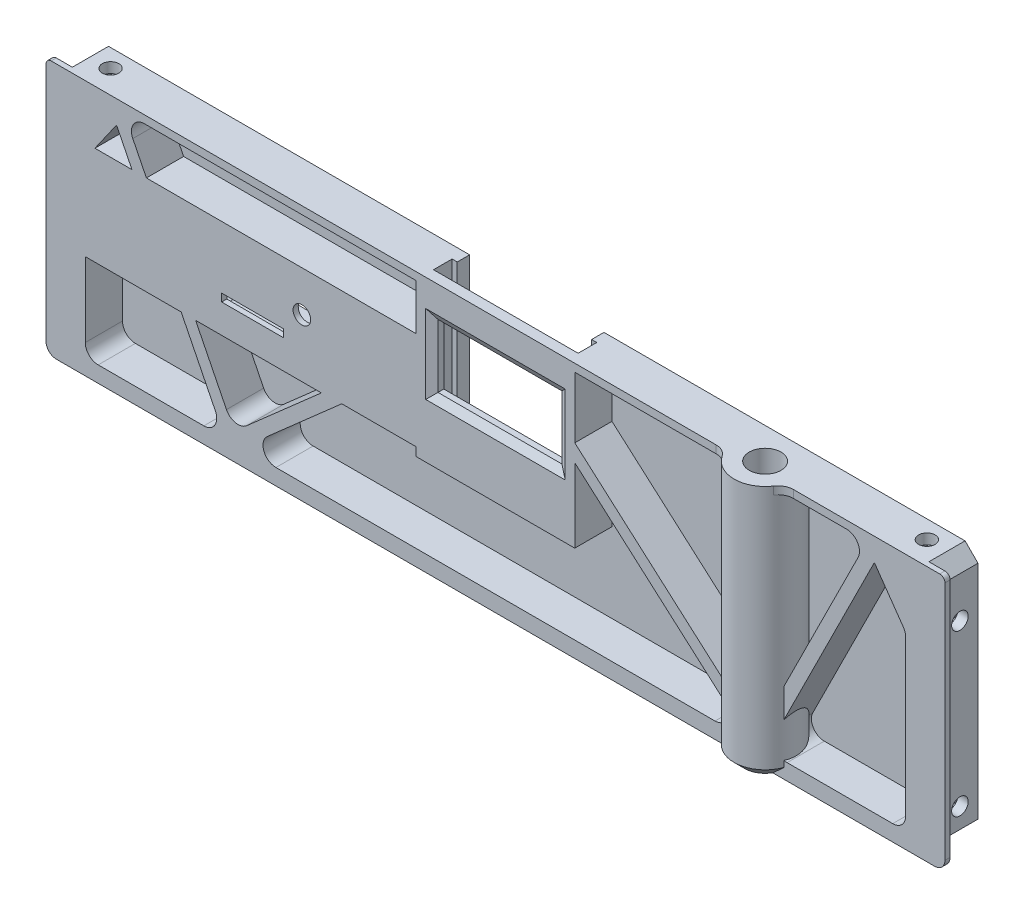
from build123d import *

# Parameters (mm, degrees)
SKETCH1_W                 = 174
SKETCH1_H                 = 51.1
BOSS_EXTRUDE1_DEPTH       = 8
SKETCH2_OUTSIDE_W         = 212.304
SKETCH2_OUTSIDE_H         = 89.404
SKETCH2_OUTSIDE_W_2       = 170.8
SKETCH2_OUTSIDE_H_2       = 47.9
CUT_EXTRUDE1_DEPTH        = 7
CHAMFER1_SIZE             = 2.5
FILLET1_R                 = 2
SKETCH3_W                 = 158.8
SKETCH3_H                 = 44.9
CUT_EXTRUDE2_DEPTH        = 7.2
BOSS_EXTRUDE2_DEPTH       = 7.2
F_3_0MM_DOWEL_HOLE1_D     = 3.2
F_3_0MM_DOWEL_HOLE1_DEPTH = 5
F_3_0MM_DOWEL_HOLE2_D     = 3.2
F_3_0MM_DOWEL_HOLE2_DEPTH = 5
CUT_EXTRUDE3_START        = -2
SKETCH10_W                = 6.25
SKETCH10_H                = 5.5
CUT_EXTRUDE3_DEPTH        = 1.8
CUT_EXTRUDE4_START        = -2
SKETCH11_W                = 5.5
SKETCH11_H                = 6.25
CUT_EXTRUDE4_DEPTH        = 1.8
BOSS_EXTRUDE3_DEPTH       = 7.2
SMALL_FIX_DEPTH           = 7.2
FILLET2_R                 = 2.5
FILLET3_R                 = 0.1
SKETCH14_W                = 30.7
SKETCH14_H                = 31
BOSS_EXTRUDE4_DEPTH       = 8
SKETCH17_W                = 28
SKETCH17_H                = 3.6
CUT_EXTRUDE6_DEPTH        = 29.5
SKETCH18_W                = 26
SKETCH18_H                = 26.5
CUT_EXTRUDE7_DEPTH        = 6
SKETCH19_W                = 24
SKETCH19_H                = 12.25
CUT_EXTRUDE8_DEPTH        = 2
CHAMFER2_SIZE             = 1.5
CHAMFER2_SIZE2            = 0.866025404
SKETCH21_W                = 174
SKETCH21_H                = 1.6
CUT_EXTRUDE10_DEPTH       = 91.94395252
BOSS_EXTRUDE5_DEPTH       = 7.2
SKETCH23_W                = 59
SKETCH23_H                = 11.6
CUT_EXTRUDE11_DEPTH       = 7
SKETCH25_W                = 35
SKETCH25_H                = 2
CUT_EXTRUDE12_DEPTH       = 7
SKETCH26_W                = 5
SKETCH26_H                = 9.4
SKETCH26_W_2              = 7
BOSS_EXTRUDE6_DEPTH       = 7
SKETCH27_R                = 1.7
SKETCH27_W                = 12
SKETCH27_H                = 1.5
CUT_EXTRUDE13_DEPTH       = 1
FILLET4_R                 = 1
BOSS_EXTRUDE8_REACH       = 102.415
SKETCH29_R                = 6
SKETCH30_R                = 3.075
CUT_EXTRUDE14_DEPTH       = 43.9
SKETCH31_W                = 12
SKETCH31_H                = 7
CUT_EXTRUDE15_DEPTH       = 1.6
CHAMFER3_SIZE             = 2
FILLET5_R                 = 3
SKETCH32_W                = 5.5
SKETCH32_H                = 1.8
SKETCH32_W_2              = 1.8
SKETCH32_H_2              = 5.5
CUT_EXTRUDE17_DEPTH       = 0.1
BOSS_EXTRUDE9_DEPTH       = 7.2
SKETCH34_W                = 23.2
SKETCH34_H                = 5.1
SKETCH34_W_2              = 10.25
SKETCH34_H_2              = 15
CUT_EXTRUDE18_DEPTH       = 7
CUT_EXTRUDE19_START       = -2
SKETCH10_2_W              = 6.25
SKETCH10_2_H              = 5.5
CUT_EXTRUDE19_DEPTH       = 1.8
SKETCH36_R                = 1.6
CUT_EXTRUDE20_DEPTH       = 5
SKETCH37_W                = 12
SKETCH37_H                = 0.5
BOSS_EXTRUDE10_DEPTH      = 1
SKETCH37_3_W              = 12
SKETCH37_3_H              = 1.5
CUT_EXTRUDE21_DEPTH       = 10


with BuildPart() as part:
    # Sketch1 → Boss-Extrude1 (new body)
    with BuildSketch(Plane.XY):
        Rectangle(SKETCH1_W, SKETCH1_H)
    extrude(amount=-BOSS_EXTRUDE1_DEPTH)

    # Sketch2 outside → Cut-Extrude1 (cut)
    with BuildSketch(Plane(origin=(0, 0, -8), x_dir=(-1, 0, 0), z_dir=(0, 0, -1))):
        Rectangle(SKETCH2_OUTSIDE_W, SKETCH2_OUTSIDE_H)
        Rectangle(SKETCH2_OUTSIDE_W_2, SKETCH2_OUTSIDE_H_2, mode=Mode.SUBTRACT)
    extrude(amount=-CUT_EXTRUDE1_DEPTH, mode=Mode.SUBTRACT)

    # Chamfer1
    chamfer1_edges = [part.edges().sort_by_distance(p)[0] for p in [
        (85.4, -23.95, -4.5),
        (85.4, 23.95, -4.5),
        (-85.4, 23.95, -4.5),
        (-85.4, -23.95, -4.5),
    ]]
    chamfer(chamfer1_edges, length=CHAMFER1_SIZE)

    # Fillet1
    fillet1_edges = [part.edges().sort_by_distance(p)[0] for p in [
        (-87, -25.55, -0.5),
        (87, -25.55, -0.5),
    ]]
    fillet(fillet1_edges, radius=FILLET1_R)

    # Sketch3 → Cut-Extrude2 (cut)
    with BuildSketch(Plane.XY):
        Rectangle(SKETCH3_W, SKETCH3_H)
    extrude(amount=-CUT_EXTRUDE2_DEPTH, mode=Mode.SUBTRACT)

    # Sketch9 → Boss-Extrude2 (add)
    with BuildSketch(Plane.XY):
        Polygon((-73.4, 22.45), (-73.4, 19.45), (-79.4, 10.88111196), (-79.4, 22.45), align=None)
    boss_extrude2 = extrude(amount=-BOSS_EXTRUDE2_DEPTH)

    # Ø3.0mm Dowel Hole1
    with Locations(Plane.ZY.offset(85.4)):
        with Locations((-4.5, 13.55), (-4.5, -17.55)):
            f_3_0mm_dowel_hole1 = Hole(F_3_0MM_DOWEL_HOLE1_D / 2, depth=F_3_0MM_DOWEL_HOLE1_DEPTH)

    # Ø3.0mm Dowel Hole2
    with Locations(Plane(origin=(0, 23.95, 0), x_dir=(1, 0, 0), z_dir=(0, 1, 0))):
        with Locations((-79, 4.5)):
            f_3_0mm_dowel_hole2 = Hole(F_3_0MM_DOWEL_HOLE2_D / 2, depth=F_3_0MM_DOWEL_HOLE2_DEPTH)

    # Sketch10 → Cut-Extrude3 (cut)
    with BuildSketch(Plane.ZY.offset(85.4).offset(CUT_EXTRUDE3_START)):
        with Locations((-4.875, 13.55)):
            Rectangle(SKETCH10_W, SKETCH10_H)
        with Locations((-4.875, -17.55)):
            Rectangle(SKETCH10_W, SKETCH10_H)
    cut_extrude3 = extrude(amount=-CUT_EXTRUDE3_DEPTH, mode=Mode.SUBTRACT)

    # Sketch11 → Cut-Extrude4 (cut)
    with BuildSketch(Plane(origin=(0, 23.95, 0), x_dir=(1, 0, 0), z_dir=(0, 1, 0)).offset(CUT_EXTRUDE4_START)):
        with Locations((-79, 4.875)):
            Rectangle(SKETCH11_W, SKETCH11_H)
    cut_extrude4 = extrude(amount=-CUT_EXTRUDE4_DEPTH, mode=Mode.SUBTRACT)

    # Mirror1: Boss-Extrude2, Ø3.0mm Dowel Hole1, Ø3.0mm Dowel Hole2, Cut-Extrude3, Cut-Extrude4 across plane
    add(boss_extrude2.mirror(Plane(origin=(0, 0, 0), x_dir=(0, 0, 1), z_dir=(1, 0, 0))))
    add(f_3_0mm_dowel_hole1.mirror(Plane(origin=(0, 0, 0), x_dir=(0, 0, 1), z_dir=(1, 0, 0))), mode=Mode.SUBTRACT)
    add(f_3_0mm_dowel_hole2.mirror(Plane(origin=(0, 0, 0), x_dir=(0, 0, 1), z_dir=(1, 0, 0))), mode=Mode.SUBTRACT)
    add(cut_extrude3.mirror(Plane(origin=(0, 0, 0), x_dir=(0, 0, 1), z_dir=(1, 0, 0))), mode=Mode.SUBTRACT)
    add(cut_extrude4.mirror(Plane(origin=(0, 0, 0), x_dir=(0, 0, 1), z_dir=(1, 0, 0))), mode=Mode.SUBTRACT)

    # Sketch12 → Boss-Extrude3 (add)
    with BuildSketch(Plane.XY.offset(-7.2)):
        with BuildLine():
            Line((-74.518667952, 21.892252734), (-51.987365652, -23.298548404))
            ThreePointArc((-51.987365652, -23.298548404), (-51.284500977, -23.83373188), (-50.431737416, -23.603006041))
            Line((-50.431737416, -23.603006041), (0, 20.784788617))
            Line((0, 20.784788617), (50.431737416, -23.603006041))
            ThreePointArc((50.431737416, -23.603006041), (51.284500977, -23.83373188), (51.987365652, -23.298548404))
            Line((51.987365652, -23.298548404), (74.518667952, 21.892252734))
            ThreePointArc((74.518667952, 21.892252734), (73.957747266, 23.568667952), (72.281332048, 23.007747266))
            Line((72.281332048, 23.007747266), (50.619958341, -20.438247045))
            Line((50.619958341, -20.438247045), (0.660693874, 23.533697727))
            ThreePointArc((0.660693874, 23.533697727), (0, 23.783042277), (-0.660693874, 23.533697727))
            Line((-0.660693874, 23.533697727), (-50.619958341, -20.438247045))
            Line((-50.619958341, -20.438247045), (-72.281332048, 23.007747266))
            ThreePointArc((-72.281332048, 23.007747266), (-73.957747266, 23.568667952), (-74.518667952, 21.892252734))
        make_face()
    extrude(amount=BOSS_EXTRUDE3_DEPTH)

    # Sketch13 → Small Fix (add)
    with BuildSketch(Plane.XY):
        Polygon((-73.4, 19.45), (-73.4, 19.648551935), (-73.301005657, 19.45), align=None)
        Polygon((73.301005657, 19.45), (73.4, 19.45), (73.4, 19.648551935), align=None)
    extrude(amount=-SMALL_FIX_DEPTH)

    # Fillet2
    fillet2_edges = [part.edges().sort_by_distance(p)[0] for p in [
        (-79.4, 10.88111196, -3.6),
        (79.4, 10.88111196, -3.6),
        (49.121735458, -22.45, -3.6),
        (-49.121735458, -22.45, -3.6),
        (72.003249519, 22.45, -3.6),
        (1.89195034, 22.45, -3.6),
        (50.619958341, -20.438247045, -3.6),
        (-1.89195034, 22.45, -3.6),
        (-72.003249519, 22.45, -3.6),
        (-50.619958341, -20.438247045, -3.6),
        (0, 20.784788617, -3.6),
        (-52.410436279, -22.45, -3.6),
        (52.410436279, -22.45, -3.6),
        (-79.4, -22.45, -3.6),
        (79.4, -22.45, -3.6),
    ]]
    fillet(fillet2_edges, radius=FILLET2_R)

    # Fillet3
    # the kernel refuses this fillet: 0.1 mm, written as the material it adds along each edge
    with BuildSketch(Plane(origin=(73.4, 19.45, 0), x_dir=(-1, 0, 0), z_dir=(0, 0, -1))) as fillet3_piece_1:
        with BuildLine():
            CenterArc((FILLET3_R * 0.520567050552, -FILLET3_R), FILLET3_R, 90, 55)
            Line((-FILLET3_R * 0.298584993737, -FILLET3_R * 0.426423563649), (0, 0))
            Line((0, 0), (FILLET3_R * 0.520567050552, 0))
        make_face()
    extrude(amount=7.330141763)
    with BuildSketch(Plane(origin=(73.301005657, 19.45, 0), x_dir=(-0.44619781310983325, -0.8949343616020129, 0), z_dir=(0, 0, -1))) as fillet3_piece_2:
        with BuildLine():
            CenterArc((FILLET3_R * 0.618818776719, -FILLET3_R), FILLET3_R, 90, 63.5)
            Line((-FILLET3_R * 0.276115584883, -FILLET3_R * 0.55380218689), (0, 0))
            Line((0, 0), (FILLET3_R * 0.618818776719, 0))
        make_face()
    extrude(amount=7.354704694)
    with BuildSketch(Plane(origin=(-73.301005657, 19.45, 0), x_dir=(0.4461978131097644, -0.8949343616020471, 0), z_dir=(0, 0, -1))) as fillet3_piece_3:
        with BuildLine():
            CenterArc((FILLET3_R * 0.618818776719, FILLET3_R), FILLET3_R, 206.5, 63.5)
            Line((-FILLET3_R * 0.276115584883, FILLET3_R * 0.55380218689), (0, 0))
            Line((0, 0), (FILLET3_R * 0.618818776719, 0))
        make_face()
    extrude(amount=7.354704694)
    with BuildSketch(Plane(origin=(-73.4, 19.45, 0), x_dir=(1, 0, 0), z_dir=(0, 0, -1))) as fillet3_piece_4:
        with BuildLine():
            CenterArc((FILLET3_R * 0.520567050552, FILLET3_R), FILLET3_R, 215, 55)
            Line((-FILLET3_R * 0.298584993737, FILLET3_R * 0.426423563649), (0, 0))
            Line((0, 0), (FILLET3_R * 0.520567050552, 0))
        make_face()
    extrude(amount=7.330141763)

    # Sketch14 → Boss-Extrude4 (add)
    with BuildSketch(Plane(origin=(0, 0, -8), x_dir=(-1, 0, 0), z_dir=(0, 0, -1))):
        with Locations((0, 8.45)):
            Rectangle(SKETCH14_W, SKETCH14_H)
    extrude(amount=-BOSS_EXTRUDE4_DEPTH)

    # Sketch17 → Cut-Extrude6 (cut)
    with BuildSketch(Plane(origin=(0, 23.95, 0), x_dir=(1, 0, 0), z_dir=(0, 1, 0))):
        with Locations((0, 3.8)):
            Rectangle(SKETCH17_W, SKETCH17_H)
    extrude(amount=-CUT_EXTRUDE6_DEPTH, mode=Mode.SUBTRACT)

    # Sketch18 → Cut-Extrude7 (cut)
    with BuildSketch(Plane(origin=(0, 0, -8), x_dir=(-1, 0, 0), z_dir=(0, 0, -1))):
        with Locations((0, 10.7)):
            Rectangle(SKETCH18_W, SKETCH18_H)
    extrude(amount=-CUT_EXTRUDE7_DEPTH, mode=Mode.SUBTRACT)

    # Sketch19 → Cut-Extrude8 (cut)
    with BuildSketch(Plane.XY):
        with Locations((0, 11.075)):
            Rectangle(SKETCH19_W, SKETCH19_H)
    extrude(amount=-CUT_EXTRUDE8_DEPTH, mode=Mode.SUBTRACT)

    # Chamfer2
    chamfer2_edges = [part.edges().sort_by_distance(p)[0] for p in [
        (-12, 11.075, 0),
        (0, 4.95, 0),
        (12, 11.075, 0),
        (0, 17.2, 0),
    ]]
    chamfer2_side = [part.faces().sort_by_distance(p)[0] for p in [
        (0, 1.106366133, 0),
    ]]
    chamfer(chamfer2_edges, length=CHAMFER2_SIZE, length2=CHAMFER2_SIZE2, reference=chamfer2_side[0])

    # Sketch21 → Cut-Extrude10 (cut, through all)
    with BuildSketch(Plane(origin=(0, 0, -1), x_dir=(-1, 0, 0), z_dir=(0, 0, -1))):
        with Locations((0, 24.75)):
            Rectangle(SKETCH21_W, SKETCH21_H)
    extrude(amount=-CUT_EXTRUDE10_DEPTH, mode=Mode.SUBTRACT)

    # Sketch22 → Boss-Extrude5 (add)
    with BuildSketch(Plane.XY):
        Polygon((-79.4, -5.55), (-33.704493823, -5.55), (-15.35, 10.604817276), (-15.35, 13.55), (-23.6, 13.55), (-79.4, 13.55), align=None)
    extrude(amount=-BOSS_EXTRUDE5_DEPTH)

    # Sketch23 → Cut-Extrude11 (cut)
    with BuildSketch(Plane(origin=(0, 0, -8), x_dir=(-1, 0, 0), z_dir=(0, 0, -1))):
        with Locations((53.6, 6.75)):
            Rectangle(SKETCH23_W, SKETCH23_H)
    extrude(amount=-CUT_EXTRUDE11_DEPTH, mode=Mode.SUBTRACT)

    # Sketch25 → Cut-Extrude12 (cut)
    with BuildSketch(Plane(origin=(0, 0, -8), x_dir=(-1, 0, 0), z_dir=(0, 0, -1))):
        with Locations((49.6, -0.05)):
            Rectangle(SKETCH25_W, SKETCH25_H)
    extrude(amount=-CUT_EXTRUDE12_DEPTH, mode=Mode.SUBTRACT)

    # Sketch26 → Boss-Extrude6 (add)
    with BuildSketch(Plane(origin=(0, 0, -8), x_dir=(-1, 0, 0), z_dir=(0, 0, -1))):
        with Locations((26.6, 7.85)):
            Rectangle(SKETCH26_W, SKETCH26_H)
        with Locations((79.6, 7.85)):
            Rectangle(SKETCH26_W_2, SKETCH26_H)
    extrude(amount=-BOSS_EXTRUDE6_DEPTH)

    # Sketch27 → Cut-Extrude13 (cut)
    with BuildSketch(Plane.XY):
        with Locations((-37.475, 5.65)):
            Circle(SKETCH27_R)
        with Locations((-47.011, 0.285)):
            Rectangle(SKETCH27_W, SKETCH27_H)
    extrude(amount=-CUT_EXTRUDE13_DEPTH, mode=Mode.SUBTRACT)

    # Fillet4
    fillet4_edges = [part.edges().sort_by_distance(p)[0] for p in [
        (87, 23.95, -0.5),
        (-87, 23.95, -0.5),
    ]]
    fillet(fillet4_edges, radius=FILLET4_R)

    # Boss-Extrude8: up to this face of the body (flat: up to its plane)
    boss_extrude8_end = Plane(part.part.faces().sort_by_distance((0, -25.55, -0.5))[0])
    # Sketch29 → Boss-Extrude8 (add, up to the picked face)
    with BuildSketch(Plane(origin=(0, 23.95, 0), x_dir=(1, 0, 0), z_dir=(0, 1, 0)), mode=Mode.PRIVATE) as boss_extrude8_sk1:
        with Locations((50.194998341, 2)):
            Circle(SKETCH29_R)
    boss_extrude8_tool1 = split(extrude(boss_extrude8_sk1.sketch, amount=-BOSS_EXTRUDE8_REACH, mode=Mode.PRIVATE), bisect_by=boss_extrude8_end, keep=Keep.BOTH, mode=Mode.PRIVATE)
    add(boss_extrude8_tool1.solids().sort_by(Axis((50.194998, 23.95, -2), (0, -1, 0)))[0])

    # Sketch30 → Cut-Extrude14 (cut)
    with BuildSketch(Plane(origin=(0, 23.95, 0), x_dir=(1, 0, 0), z_dir=(0, 1, 0))):
        with Locations(Location((50.194998341, 2, 0), (0, 0, 270))):
            Circle(SKETCH30_R)
    extrude(amount=-CUT_EXTRUDE14_DEPTH, mode=Mode.SUBTRACT)

    # Sketch31 → Cut-Extrude15 (cut)
    with BuildSketch(Plane.XZ.offset(23.95)):
        with Locations((50.194998341, -4.5)):
            Rectangle(SKETCH31_W, SKETCH31_H)
    extrude(amount=CUT_EXTRUDE15_DEPTH, mode=Mode.SUBTRACT)

    # Chamfer3
    chamfer3_edges = [part.edges().sort_by_distance(p)[0] for p in [
        (50.194998341, -25.55, 4),
    ]]
    chamfer(chamfer3_edges, length=CHAMFER3_SIZE)

    # Fillet5
    fillet5_edges = [part.edges().sort_by_distance(p)[0] for p in [
        (55.85185259, 23.2, 0),
        (44.538144091, 23.2, 0),
    ]]
    fillet(fillet5_edges, radius=FILLET5_R)

    # Sketch32 → Cut-Extrude17 (cut)
    with BuildSketch(Plane(origin=(0, 0, -1.75), x_dir=(-1, 0, 0), z_dir=(0, 0, -1))):
        with Locations((-79, 21.05)):
            Rectangle(SKETCH32_W, SKETCH32_H)
        with Locations((-82.5, 13.55)):
            Rectangle(SKETCH32_W_2, SKETCH32_H_2)
        with Locations((-82.5, -17.55)):
            Rectangle(SKETCH32_W_2, SKETCH32_H_2)
        with Locations((79, 21.05)):
            Rectangle(SKETCH32_W, SKETCH32_H)
        with Locations((82.5, 13.55)):
            Rectangle(SKETCH32_W_2, SKETCH32_H_2)
        with Locations((82.5, -17.55)):
            Rectangle(SKETCH32_W_2, SKETCH32_H_2)
    extrude(amount=-CUT_EXTRUDE17_DEPTH, mode=Mode.SUBTRACT)

    # Sketch35 → Boss-Extrude9 (add)
    with BuildSketch(Plane.XY):
        Polygon((-29.749581898, -5.399483433), (-15.35, -5.399483433), (-15.35, 7.27439451), align=None)
    extrude(amount=-BOSS_EXTRUDE9_DEPTH)

    # Sketch34 → Cut-Extrude18 (cut)
    with BuildSketch(Plane(origin=(0, 0, -8), x_dir=(-1, 0, 0), z_dir=(0, 0, -1))):
        with Locations((65.011, -1.6)):
            Rectangle(SKETCH34_W, SKETCH34_H)
        with Locations((29.1, 5.05)):
            Rectangle(SKETCH34_W_2, SKETCH34_H_2)
    extrude(amount=-CUT_EXTRUDE18_DEPTH, mode=Mode.SUBTRACT)

    # Sketch10<2> → Cut-Extrude19 (cut)
    with BuildSketch(Plane.ZY.offset(85.4).offset(CUT_EXTRUDE19_START)):
        with Locations((-4.875, 13.55)):
            Rectangle(SKETCH10_2_W, SKETCH10_2_H)
    extrude(amount=-CUT_EXTRUDE19_DEPTH, mode=Mode.SUBTRACT)

    # Sketch36 → Cut-Extrude20 (cut)
    with BuildSketch(Plane.ZY.offset(85.4)):
        with Locations((-4.5, 13.55)):
            Circle(SKETCH36_R)
    extrude(amount=-CUT_EXTRUDE20_DEPTH, mode=Mode.SUBTRACT)

    # Sketch37 → Boss-Extrude10 (add)
    with BuildSketch(Plane.XY):
        with Locations((-47.011, -0.215)):
            Rectangle(SKETCH37_W, SKETCH37_H)
    extrude(amount=-BOSS_EXTRUDE10_DEPTH)

    # Sketch37<3> → Cut-Extrude21 (cut)
    with BuildSketch(Plane.XY):
        with Locations((-47.011, 0.785)):
            Rectangle(SKETCH37_3_W, SKETCH37_3_H)
    extrude(amount=-CUT_EXTRUDE21_DEPTH, mode=Mode.SUBTRACT)


solid = part.part
